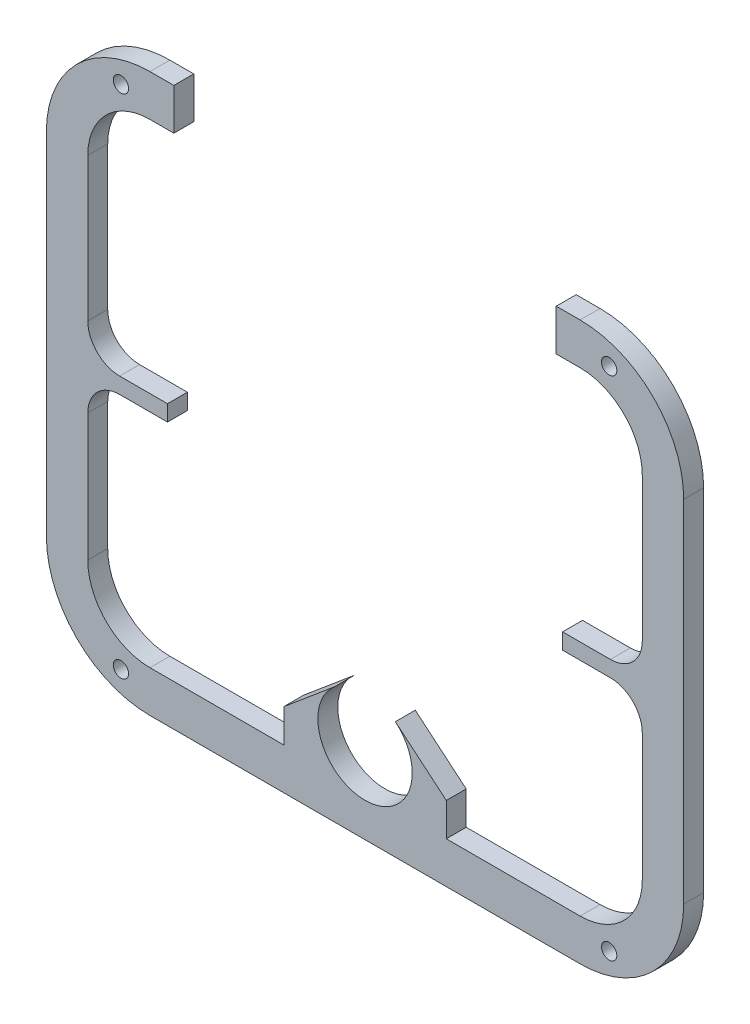
from build123d import *

# Parameters (mm, degrees)
SKETCH1_R           = 0.6096
BOSS_EXTRUDE1_DEPTH = 1.5875
CUT_EXTRUDE1_REACH  = 35.788
SKETCH2_W           = 3.155094666
SKETCH2_H           = 2.647438771
SKETCH2_W_2         = 30.48
SKETCH2_H_2         = 3.302
FILLET1_R           = 2.54


with BuildPart() as part:
    # Sketch1 → Boss-Extrude1 (new body)
    with BuildSketch(Plane.XY):
        with BuildLine():
            ThreePointArc((25.4, 13.97), (22.982166479, 19.807166479), (17.145, 22.225))
            Line((17.145, 22.225), (-17.145, 22.225))
            ThreePointArc((-17.145, 22.225), (-22.982166479, 19.807166479), (-25.4, 13.97))
            Line((-25.4, 13.97), (-25.4, -13.97))
            ThreePointArc((-25.4, -13.97), (-22.982166479, -19.807166479), (-17.145, -22.225))
            Line((-17.145, -22.225), (17.145, -22.225))
            ThreePointArc((17.145, -22.225), (22.982166479, -19.807166479), (25.4, -13.97))
            Line((25.4, -13.97), (25.4, 13.97))
        make_face()
        with BuildLine():
            Line((-15.748, 0), (-22.098, 0))
            Line((-22.098, 0), (-22.098, 13.97))
            ThreePointArc((-22.098, 13.97), (-20.647299887, 17.472299887), (-17.145, 18.923))
            Line((-17.145, 18.923), (17.145, 18.923))
            ThreePointArc((17.145, 18.923), (20.647299887, 17.472299887), (22.098, 13.97))
            Line((22.098, 13.97), (22.098, 0))
            Line((22.098, 0), (15.748, 0))
            Line((15.748, 0), (15.748, -1.27))
            Line((15.748, -1.27), (22.098, -1.27))
            Line((22.098, -1.27), (22.098, -13.97))
            ThreePointArc((22.098, -13.97), (20.647299887, -17.472299887), (17.145, -18.923))
            Line((17.145, -18.923), (9.632094666, -18.923))
            Line((9.632094666, -18.923), (2.416367182, -12.868285729))
            ThreePointArc((2.416367182, -12.868285729), (0, -19.5072), (-2.416367182, -12.868285729))
            Line((-2.416367182, -12.868285729), (-9.632094666, -18.923))
            Line((-9.632094666, -18.923), (-17.145, -18.923))
            ThreePointArc((-17.145, -18.923), (-20.647299887, -17.472299887), (-22.098, -13.97))
            Line((-22.098, -13.97), (-22.098, -1.27))
            Line((-22.098, -1.27), (-15.748, -1.27))
            Line((-15.748, -1.27), (-15.748, 0))
        make_face(mode=Mode.SUBTRACT)
        with Locations((-19.457528855, -20.193)):
            Circle(SKETCH1_R, mode=Mode.SUBTRACT)
        with Locations((19.457528855, -20.193)):
            Circle(SKETCH1_R, mode=Mode.SUBTRACT)
        with Locations((19.457528855, 20.193)):
            Circle(SKETCH1_R, mode=Mode.SUBTRACT)
        with Locations((-19.457528855, 20.193)):
            Circle(SKETCH1_R, mode=Mode.SUBTRACT)
    extrude(amount=BOSS_EXTRUDE1_DEPTH)

    # Sketch2 → Cut-Extrude1 (cut, up to next)
    with BuildSketch(Plane.XY.offset(1.5875), mode=Mode.PRIVATE) as cut_extrude1_sk1:
        with Locations((-8.054547333, -17.599280615)):
            Rectangle(SKETCH2_W, SKETCH2_H)
    cut_extrude1_tool1 = extrude(cut_extrude1_sk1.sketch, amount=-CUT_EXTRUDE1_REACH, mode=Mode.PRIVATE) & part.part
    # Sketch2 → Cut-Extrude1 (cut, up to next)
    with BuildSketch(Plane.XY.offset(1.5875), mode=Mode.PRIVATE) as cut_extrude1_sk2:
        with Locations((8.054547333, -17.599280615)):
            Rectangle(SKETCH2_W, SKETCH2_H)
    cut_extrude1_tool2 = extrude(cut_extrude1_sk2.sketch, amount=-CUT_EXTRUDE1_REACH, mode=Mode.PRIVATE) & part.part
    # Sketch2 → Cut-Extrude1 (cut, up to next)
    with BuildSketch(Plane.XY.offset(1.5875), mode=Mode.PRIVATE) as cut_extrude1_sk3:
        with Locations((0, 20.574)):
            Rectangle(SKETCH2_W_2, SKETCH2_H_2)
    cut_extrude1_tool3 = extrude(cut_extrude1_sk3.sketch, amount=-CUT_EXTRUDE1_REACH, mode=Mode.PRIVATE) & part.part
    add(cut_extrude1_tool1.solids().sort_by_distance((-8.054547, -17.599281, 1.5875))[0], mode=Mode.SUBTRACT)
    add(cut_extrude1_tool2.solids().sort_by_distance((8.054547, -17.599281, 1.5875))[0], mode=Mode.SUBTRACT)
    add(cut_extrude1_tool3.solids().sort_by_distance((0, 20.574, 1.5875))[0], mode=Mode.SUBTRACT)

    # Fillet1
    fillet1_edges = [part.edges().sort_by_distance(p)[0] for p in [
        (22.098, -1.27, 0.79375),
        (22.098, 0, 0.79375),
        (-22.098, 0, 0.79375),
        (-22.098, -1.27, 0.79375),
    ]]
    fillet(fillet1_edges, radius=FILLET1_R)


solid = part.part
